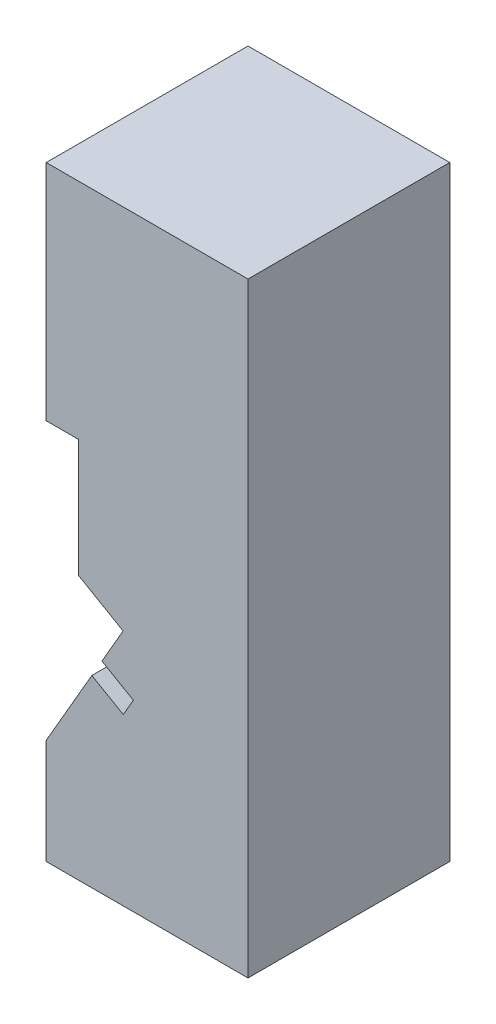
from build123d import *

# Parameters (mm, degrees)
SKETCH1_W           = 25
SKETCH1_H           = 25
BOSS_EXTRUDE2_DEPTH = 37.5
CUT_EXTRUDE2_DEPTH  = 12.5


with BuildPart() as part:
    # Sketch1 → Boss-Extrude2 (new, symmetric)
    with BuildSketch(Plane(origin=(0, 0, 0), x_dir=(1, 0, 0), z_dir=(0, 1, 0))):
        Rectangle(SKETCH1_W, SKETCH1_H)
    extrude(amount=BOSS_EXTRUDE2_DEPTH, both=True)

    # Sketch5 → Cut-Extrude2 (cut)
    with BuildSketch(Plane.XY.offset(12.5)):
        Polygon((-8.5, -4.809401077), (-2.973720558, -8), (-5.598720558, -12.54663337), (-1.701606241, -14.79663337), (-2.951606241, -16.961696879), (-6.848720558, -14.711696879), (-12.5, -24.5), (-12.5, 9.790598923), (-8.5, 9.790598923), align=None)
    extrude(amount=-CUT_EXTRUDE2_DEPTH, mode=Mode.SUBTRACT)


solid = part.part
